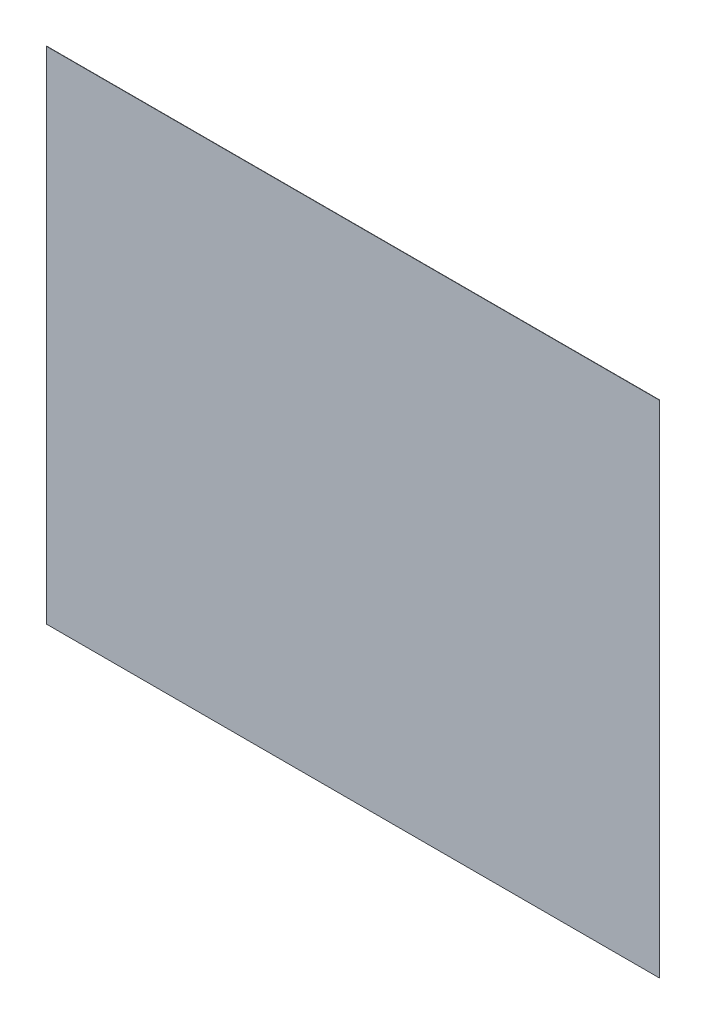
from build123d import *

# Parameters (mm, degrees)
SKETCH1_W           = 1991
SKETCH1_H           = 1625
BOSS_EXTRUDE1_DEPTH = 1


with BuildPart() as part:
    # Sketch1 → Boss-Extrude1 (new body)
    with BuildSketch(Plane.XY):
        with Locations((995.5, 812.5)):
            Rectangle(SKETCH1_W, SKETCH1_H)
    extrude(amount=BOSS_EXTRUDE1_DEPTH)


solid = part.part
